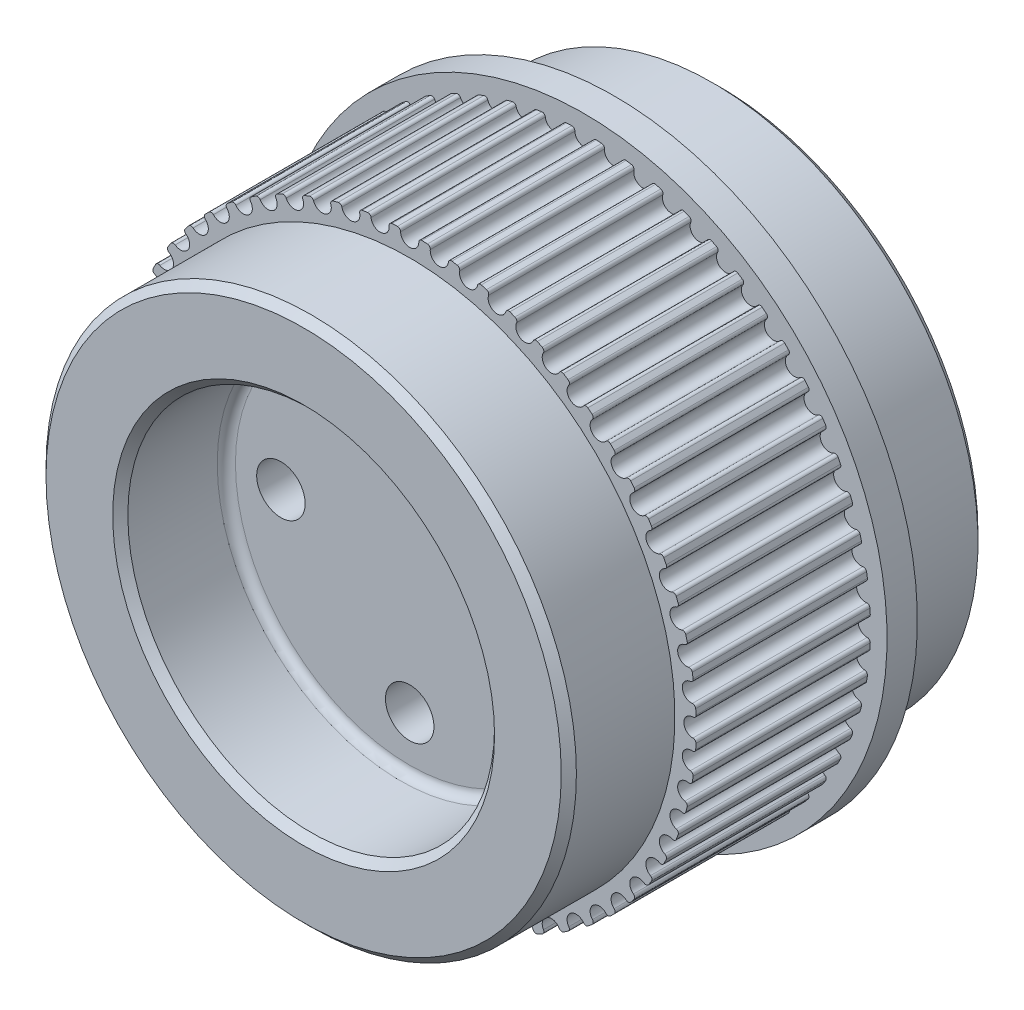
from build123d import *

# Parameters (mm, degrees)
SKETCHREVOLVEGEARBELT02_W       = 11.5
SKETCHREVOLVEGEARBELT02_H       = 18.908092887
TOOTHEXTRUDECUTGEARBELT02_DEPTH = 11.5
PATTERNGEARBELT02_COUNT         = 60
SKETCH_2_R                      = 20
EXTRUDE_1_DEPTH                 = 2
SKETCH_7_R                      = 17.5
SKETCH_7_R_2                    = 12.1
EXTRUDE_2_DEPTH                 = 7
EXTRUDE_START                   = 7
SKETCH_8_R                      = 17.5
EXTRUDE_3_DEPTH                 = 7
CHAMFER_1_SIZE                  = 0.5
SKETCH_5_R                      = 1.6
CUT_EXTRUDE_2_DEPTH             = 40.449334595
SKETCH_5_4_R                    = 3.25
SKETCH_5_4_R_2                  = 1.6
CUT_EXTRUDE_3_DEPTH             = 4
SKETCH_9_R                      = 3
CUT_EXTRUDE_4_DEPTH             = 4
CHAMFER_2_SIZE                  = 0.3
FILLET_1_R                      = 0.6


with BuildPart() as part:
    # SketchRevolveGearBelt02 → GearBelt02 (revolve)
    with BuildSketch(Plane(origin=(0, 0, 0), x_dir=(0, 0, -1), z_dir=(1, 0, 0))):
        with Locations((5.75, 9.454046444)):
            Rectangle(SKETCHREVOLVEGEARBELT02_W, SKETCHREVOLVEGEARBELT02_H)
    revolve(axis=Axis((0, 0, 0), (0, 0, -1)))

    # SketchToothGearBelt02 → ToothExtrudeCutGearBelt02 (cut)
    with BuildSketch(Plane.XY):
        with BuildLine():
            Line((-0.810458232, 18.890715552), (0, 21.448092849))
            Line((0, 21.448092849), (0.810458232, 18.890715552))
            ThreePointArc((0.810458232, 18.890715552), (0.662199993, 18.834818977), (0.599999991, 18.68909289))
            ThreePointArc((0.599999991, 18.68909289), (0, 18.089092899), (-0.599999991, 18.68909289))
            ThreePointArc((-0.599999991, 18.68909289), (-0.662199993, 18.834818977), (-0.810458232, 18.890715552))
        make_face()
    toothextrudecutgearbelt02 = extrude(amount=-TOOTHEXTRUDECUTGEARBELT02_DEPTH, mode=Mode.SUBTRACT)

    # PatternGearBelt02: ToothExtrudeCutGearBelt02 ×60 about axis
    patterngearbelt02_axis = Axis((0, 0, 55), (0, 0, -1))
    for i in range(1, PATTERNGEARBELT02_COUNT):
        add(toothextrudecutgearbelt02.rotate(patterngearbelt02_axis, i * 360 / PATTERNGEARBELT02_COUNT), mode=Mode.SUBTRACT)

    # Эскиз2 → Бобышка-Вытянуть1 (add)
    with BuildSketch(Plane(origin=(0, 0, -11.5), x_dir=(-1, 0, 0), z_dir=(0, 0, -1))):
        Circle(SKETCH_2_R)
    extrude(amount=EXTRUDE_1_DEPTH)

    # Эскиз7 → Бобышка-Вытянуть2 (add)
    with BuildSketch(Plane.XY):
        Circle(SKETCH_7_R)
        Circle(SKETCH_7_R_2, mode=Mode.SUBTRACT)
    extrude(amount=EXTRUDE_2_DEPTH)

    # Эскиз8 → Бобышка-Вытянуть3 (add)
    with BuildSketch(Plane(origin=(0, 0, -13.5), x_dir=(-1, 0, 0), z_dir=(0, 0, -1)).offset(EXTRUDE_START)):
        Circle(SKETCH_8_R)
    extrude(amount=-EXTRUDE_3_DEPTH)

    # Фаска1
    chamfer_1_edges = [part.edges().sort_by_distance(p)[0] for p in [
        (17.5, 0, -20.5),
        (-17.5, 0, 7),
        (-12.1, 0, 7),
    ]]
    chamfer(chamfer_1_edges, length=CHAMFER_1_SIZE)

    # Эскиз5 → Вырез-Вытянуть2 (cut, through all)
    with BuildSketch(Plane.XY.offset(-20.5)):
        with Locations((0, 8.5)):
            Circle(SKETCH_5_R)
        with Locations((8.5, 0)):
            Circle(SKETCH_5_R)
        with Locations((0, -8.5)):
            Circle(SKETCH_5_R)
        with Locations((-8.5, 0)):
            Circle(SKETCH_5_R)
    extrude(amount=CUT_EXTRUDE_2_DEPTH, mode=Mode.SUBTRACT)

    # Эскиз5<4> → Вырез-Вытянуть3 (cut)
    # profile 1 of 4: a face of its own
    with BuildSketch(Plane.XY.offset(-20.5)):
        with Locations((0, 8.5)):
            Circle(SKETCH_5_4_R)
        with Locations((0, 8.5)):
            Circle(SKETCH_5_4_R_2, mode=Mode.SUBTRACT)
    # profile 2 of 4: a face of its own
    with BuildSketch(Plane.XY.offset(-20.5)):
        with Locations((8.5, 0)):
            Circle(SKETCH_5_4_R)
        with Locations((8.5, 0)):
            Circle(SKETCH_5_4_R_2, mode=Mode.SUBTRACT)
    # profile 3 of 4: a face of its own
    with BuildSketch(Plane.XY.offset(-20.5)):
        with Locations((0, -8.5)):
            Circle(SKETCH_5_4_R)
        with Locations((0, -8.5)):
            Circle(SKETCH_5_4_R_2, mode=Mode.SUBTRACT)
    # profile 4 of 4: a face of its own
    with BuildSketch(Plane.XY.offset(-20.5)):
        with Locations((-8.5, 0)):
            Circle(SKETCH_5_4_R)
        with Locations((-8.5, 0)):
            Circle(SKETCH_5_4_R_2, mode=Mode.SUBTRACT)
    extrude(amount=CUT_EXTRUDE_3_DEPTH, mode=Mode.SUBTRACT)

    # Эскиз9 → Вырез-Вытянуть4 (cut)
    with BuildSketch(Plane(origin=(0, 0, -20.5), x_dir=(-1, 0, 0), z_dir=(0, 0, -1))):
        Circle(SKETCH_9_R)
    extrude(amount=-CUT_EXTRUDE_4_DEPTH, mode=Mode.SUBTRACT)

    # Фаска2
    chamfer_2_edges = [part.edges().sort_by_distance(p)[0] for p in [
        (3, 0, -20.5),
    ]]
    chamfer(chamfer_2_edges, length=CHAMFER_2_SIZE)

    # Скругление1
    fillet_1_edges = [part.edges().sort_by_distance(p)[0] for p in [
        (-12.1, 0, 0),
    ]]
    fillet(fillet_1_edges, radius=FILLET_1_R)


solid = part.part
